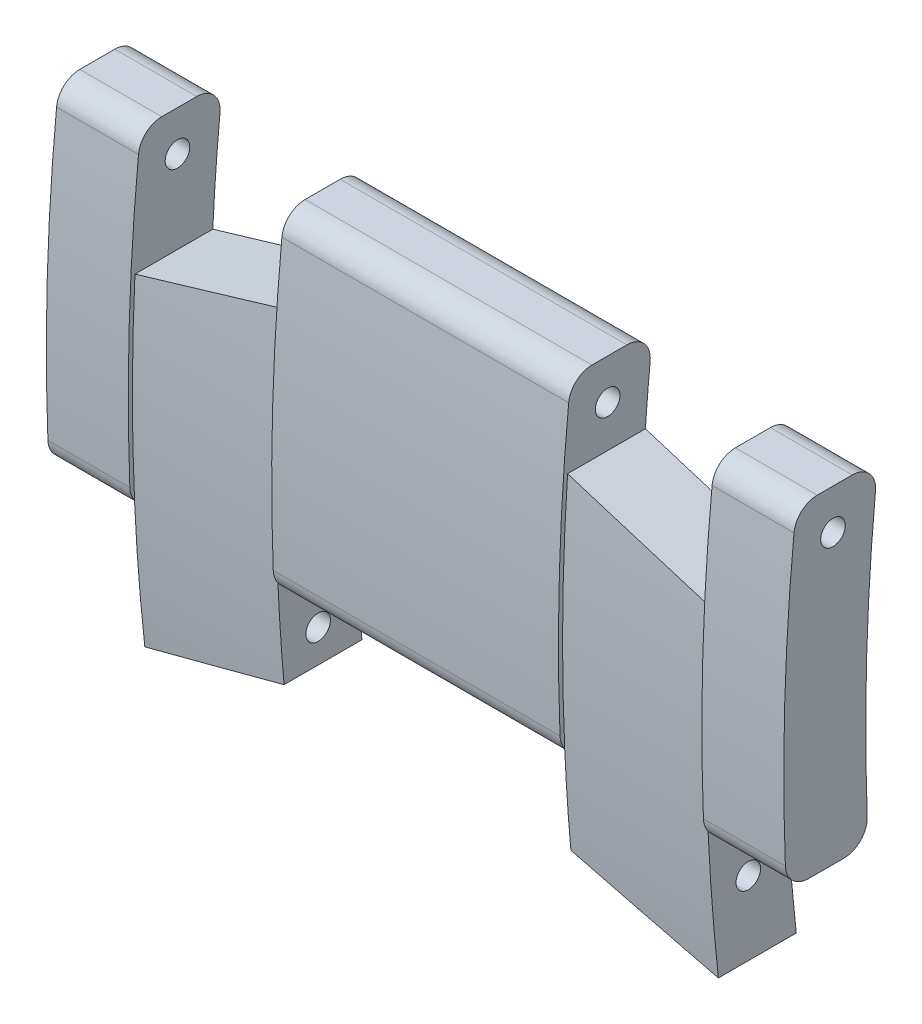
from build123d import *

# Parameters (mm, degrees)
BOSS_EXTRUDE2_DEPTH = 5
SKETCH8_R           = 50
CUT_EXTRUDE6_DEPTH  = 20
SKETCH9_OUTSIDE_W   = 10.609
SKETCH9_OUTSIDE_H   = 17.306
SKETCH9_OUTSIDE_R   = 50
CUT_EXTRUDE7_DEPTH  = 20
SKETCH11_W          = 2
SKETCH11_H          = 8
SKETCH11_W_2        = 7
BOSS_EXTRUDE4_DEPTH = 2
SKETCH12_OUTSIDE_W  = 9.573
SKETCH12_OUTSIDE_H  = 17.27
SKETCH12_OUTSIDE_R  = 50
CUT_EXTRUDE8_DEPTH  = 20
SKETCH13_R          = 0.3
CUT_EXTRUDE10_DEPTH = 20.924858845
SKETCH14_R          = 0.3
CUT_EXTRUDE11_DEPTH = 20
FILLET1_R           = 0.57


with BuildPart() as part:
    # Sketch1 → Boss-Extrude2 (new body)
    with BuildSketch(Plane.XY):
        Polygon((0, 0), (0, 8), (2, 8), (2, 5), (5.5, 6), (5.5, 8), (12.5, 8), (12.5, 6), (16, 5), (16, 8), (18, 8), (18, 0), (16, 0), (16, -3), (12.5, -2), (12.5, 0), (5.5, 0), (5.5, -2), (2, -3), (2, 0), align=None)
    extrude(amount=BOSS_EXTRUDE2_DEPTH)

    # Sketch8 → Cut-Extrude6 (cut)
    with BuildSketch(Plane(origin=(0, 0, 0), x_dir=(0, 0, -1), z_dir=(1, 0, 0))):
        with Locations((49, 2.5)):
            Circle(SKETCH8_R)
    extrude(amount=CUT_EXTRUDE6_DEPTH, mode=Mode.SUBTRACT)

    # Sketch9 outside → Cut-Extrude7 (cut)
    with BuildSketch(Plane(origin=(0, 0, 0), x_dir=(0, 0, -1), z_dir=(1, 0, 0))):
        with Locations((-2.8485, 2.5)):
            Rectangle(SKETCH9_OUTSIDE_W, SKETCH9_OUTSIDE_H)
        with Locations((47.1, 2.5)):
            Circle(SKETCH9_OUTSIDE_R, mode=Mode.SUBTRACT)
    extrude(amount=CUT_EXTRUDE7_DEPTH, mode=Mode.SUBTRACT)

    # Sketch11 → Boss-Extrude4 (add)
    with BuildSketch(Plane.XY.offset(4)):
        with Locations((1, 4)):
            Rectangle(SKETCH11_W, SKETCH11_H)
        with Locations((9, 4)):
            Rectangle(SKETCH11_W_2, SKETCH11_H)
        with Locations((17, 4)):
            Rectangle(SKETCH11_W, SKETCH11_H)
    extrude(amount=-BOSS_EXTRUDE4_DEPTH)

    # Sketch12 outside → Cut-Extrude8 (cut)
    with BuildSketch(Plane(origin=(0, 0, 0), x_dir=(0, 0, -1), z_dir=(1, 0, 0))):
        with Locations((-2.3485, 2.5)):
            Rectangle(SKETCH12_OUTSIDE_W, SKETCH12_OUTSIDE_H)
        with Locations((47, 2.5)):
            Circle(SKETCH12_OUTSIDE_R, mode=Mode.SUBTRACT)
    extrude(amount=CUT_EXTRUDE8_DEPTH, mode=Mode.SUBTRACT)

    # Sketch13 → Cut-Extrude10 (cut, through all)
    with BuildSketch(Plane(origin=(0, 0, 0), x_dir=(0, 0, -1), z_dir=(1, 0, 0))):
        with Locations(Location((-1.799307082, 7.02, 0), (0, 0, 270))):
            Circle(SKETCH13_R)
    extrude(amount=CUT_EXTRUDE10_DEPTH, mode=Mode.SUBTRACT)

    # Sketch14 → Cut-Extrude11 (cut)
    with BuildSketch(Plane(origin=(0, 0, 0), x_dir=(0, 0, -1), z_dir=(1, 0, 0))):
        with Locations(Location((-1.865607241, -1.2, 0), (0, 0, 270))):
            Circle(SKETCH14_R)
    extrude(amount=CUT_EXTRUDE11_DEPTH, mode=Mode.SUBTRACT)

    # Fillet1
    # the kernel refuses this fillet: 0.57 mm, written as the material it takes off along each edge
    with BuildSketch(Plane(origin=(19.370719987, 0, 2.937460889), x_dir=(0, 0, -1), z_dir=(-1, 0, 0))) as fillet1_piece_1:
        with BuildLine():
            CenterArc((0.545153795, -0.57), FILLET1_R, 90, 87.762310927)
            ThreePointArc((-0.024411551, -0.547744285), (-0.012956585, -0.273838681), (0, 0))
            Line((0, 0), (0.545153795, 0))
        make_face()
    extrude(amount=3.370719987, mode=Mode.SUBTRACT)
    with BuildSketch(Plane(origin=(19.28998783, 8, 2.696579359), x_dir=(0, 0, -1), z_dir=(-1, 0, 0)), Plane(origin=(3.28998783, 8, 2.696579359), x_dir=(0, 0, -1), z_dir=(-1, 0, 0))) as fillet1_piece_2:
        with BuildLine():
            CenterArc((0.513045529, 0.57), FILLET1_R, 185.724026079, 84.275973921)
            ThreePointArc((-0.054112356, 0.513149909), (-0.02771814, 0.25650515), (0, 0))
            Line((0, 0), (0.513045529, 0))
        make_face()
    extrude(amount=4.57997566, mode=Mode.SUBTRACT)
    with BuildSketch(Plane(origin=(12.5, 0, 2.937460889), x_dir=(0, 0, -1), z_dir=(-1, 0, 0))) as fillet1_piece_3:
        with BuildLine():
            CenterArc((0.545153795, -0.57), FILLET1_R, 90, 87.762310927)
            ThreePointArc((-0.024411551, -0.547744285), (-0.012956585, -0.273838681), (0, 0))
            Line((0, 0), (0.545153795, 0))
        make_face()
    extrude(amount=7, mode=Mode.SUBTRACT)
    with BuildSketch(Plane(origin=(13.78998783, 8, 2.696579359), x_dir=(0, 0, -1), z_dir=(-1, 0, 0))) as fillet1_piece_4:
        with BuildLine():
            CenterArc((0.513045529, 0.57), FILLET1_R, 185.724026079, 84.275973921)
            ThreePointArc((-0.054112356, 0.513149909), (-0.02771814, 0.25650515), (0, 0))
            Line((0, 0), (0.513045529, 0))
        make_face()
    extrude(amount=9.57997566, mode=Mode.SUBTRACT)
    with BuildSketch(Plane(origin=(2, 0, 2.937460889), x_dir=(0, 0.9990083494707687, 0.0445232263845563), z_dir=(-1, 0, 0))) as fillet1_piece_5:
        with BuildLine():
            CenterArc((0.545162753, 0.569991432), FILLET1_R, 182.551836528, 87.762310927)
            Line((-0.024272006, 0.544613193), (0, 0))
            ThreePointArc((0, 0), (0.274143997, -0.000751555), (0.548287995, 0))
        make_face()
    extrude(amount=3.370719987, mode=Mode.SUBTRACT)
    with BuildSketch(Plane(origin=(2, 0, 0.937460889), x_dir=(0, 0.9990278617443559, 0.04408323330360469), z_dir=(-1, 0, 0)), Plane(origin=(19.489241357, 0, 0.937460889), x_dir=(0, 0.9990278617443559, 0.04408323330360409), z_dir=(-1, 0, 0))) as fillet1_piece_6:
        with BuildLine():
            CenterArc((0.595706111, -0.569990001), FILLET1_R, 90.339381978, 92.187220026)
            Line((0.02626023, -0.595117444), (0, 0))
            ThreePointArc((0, 0), (0.296164915, -0.000877144), (0.592329831, 0))
        make_face()
    extrude(amount=3.489241357, mode=Mode.SUBTRACT)
    with BuildSketch(Plane(origin=(3.581343655, 8, 0.696579359), x_dir=(0, 0, 1), z_dir=(-1, 0, 0))) as fillet1_piece_7:
        with BuildLine():
            CenterArc((0.632537462, -0.57), FILLET1_R, 90, 95.594572842)
            ThreePointArc((0.065252578, -0.625568519), (0.033609947, -0.312681655), (0, 0))
            Line((0, 0), (0.632537462, 0))
        make_face()
    extrude(amount=5.16268731, mode=Mode.SUBTRACT)
    with BuildSketch(Plane(origin=(14.081343655, 8, 0.696579359), x_dir=(0, -0.9946037861150897, 0.1037463669027923), z_dir=(-1, 0, 0))) as fillet1_piece_8:
        with BuildLine():
            CenterArc((0.632547622, 0.569988725), FILLET1_R, 174.045055794, 95.594572842)
            Line((0.065623464, 0.629124155), (0, 0))
            ThreePointArc((0, 0), (0.314481268, 0.000988994), (0.628962535, 0))
        make_face()
    extrude(amount=10.16268731, mode=Mode.SUBTRACT)
    with BuildSketch(Plane(origin=(19.581343655, 8, 0.696579359), x_dir=(0, -0.9946037861150897, 0.1037463669027923), z_dir=(-1, 0, 0))) as fillet1_piece_9:
        with BuildLine():
            CenterArc((0.632547622, 0.569988725), FILLET1_R, 174.045055794, 95.594572842)
            Line((0.065623464, 0.629124155), (0, 0))
            ThreePointArc((0, 0), (0.314481268, 0.000988994), (0.628962535, 0))
        make_face()
    extrude(amount=5.16268731, mode=Mode.SUBTRACT)
    with BuildSketch(Plane(origin=(12.5, 0, 0.937460889), x_dir=(0, 0.9990278617443559, 0.04408323330360469), z_dir=(-1, 0, 0))) as fillet1_piece_10:
        with BuildLine():
            CenterArc((0.595706111, -0.569990001), FILLET1_R, 90.339381978, 92.187220026)
            Line((0.02626023, -0.595117444), (0, 0))
            ThreePointArc((0, 0), (0.296164915, -0.000877144), (0.592329831, 0))
        make_face()
    extrude(amount=7, mode=Mode.SUBTRACT)


solid = part.part
